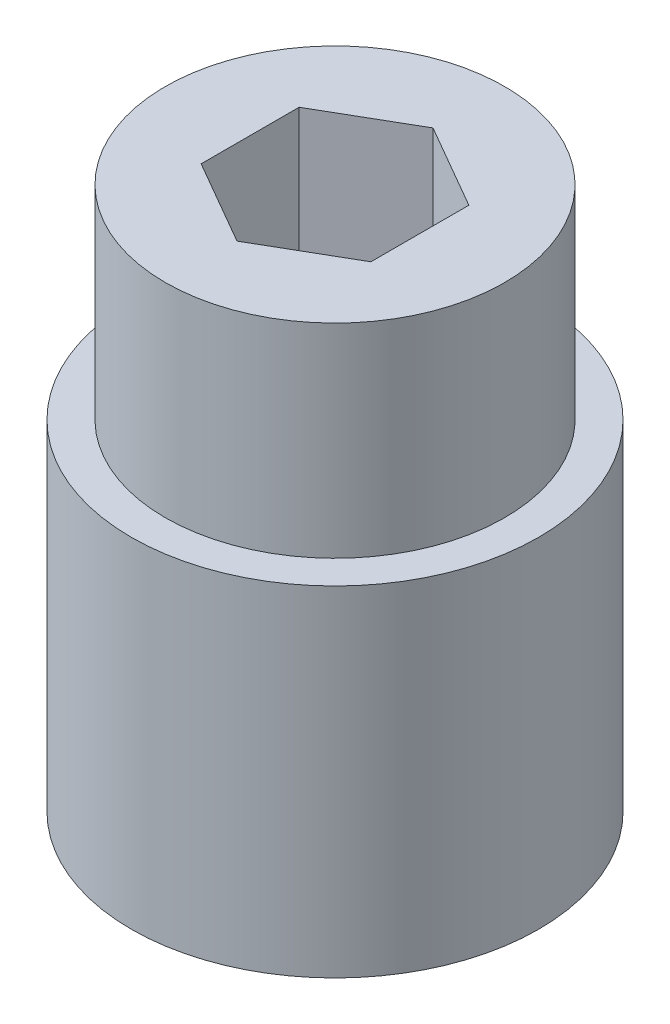
from build123d import *

# Parameters (mm, degrees)
SKETCH1_R           = 7
BOSS_EXTRUDE1_DEPTH = 10
SKETCH2_R           = 5
BOSS_EXTRUDE2_DEPTH = 6
CUT_EXTRUDE2_DEPTH  = 19.814887722
SKETCH5_OUTSIDE_W   = 21.092
SKETCH5_OUTSIDE_H   = 21.092
SKETCH5_OUTSIDE_R   = 6
CUT_EXTRUDE3_DEPTH  = 15.071247279


with BuildPart() as part:
    # Sketch1 → Boss-Extrude1 (new body)
    with BuildSketch(Plane(origin=(0, 0, 0), x_dir=(1, 0, 0), z_dir=(0, 1, 0))):
        Circle(SKETCH1_R)
    extrude(amount=BOSS_EXTRUDE1_DEPTH)

    # Sketch2 → Boss-Extrude2 (add)
    with BuildSketch(Plane(origin=(0, 10, 0), x_dir=(1, 0, 0), z_dir=(0, 1, 0))):
        Circle(SKETCH2_R)
    extrude(amount=BOSS_EXTRUDE2_DEPTH)

    # Sketch4 → Cut-Extrude2 (cut, through all)
    with BuildSketch(Plane(origin=(0, 16, 0), x_dir=(1, 0, 0), z_dir=(0, 1, 0))):
        Polygon((2.5, 1.443375673), (0, 2.886751346), (-2.5, 1.443375673), (-2.5, -1.443375673), (0, -2.886751346), (2.5, -1.443375673), align=None)
    extrude(amount=-CUT_EXTRUDE2_DEPTH, mode=Mode.SUBTRACT)

    # Sketch5 outside → Cut-Extrude3 (cut, through all)
    with BuildSketch(Plane(origin=(0, 10, 0), x_dir=(1, 0, 0), z_dir=(0, 1, 0))):
        Rectangle(SKETCH5_OUTSIDE_W, SKETCH5_OUTSIDE_H)
        Circle(SKETCH5_OUTSIDE_R, mode=Mode.SUBTRACT)
    extrude(amount=-CUT_EXTRUDE3_DEPTH, mode=Mode.SUBTRACT)


solid = part.part
